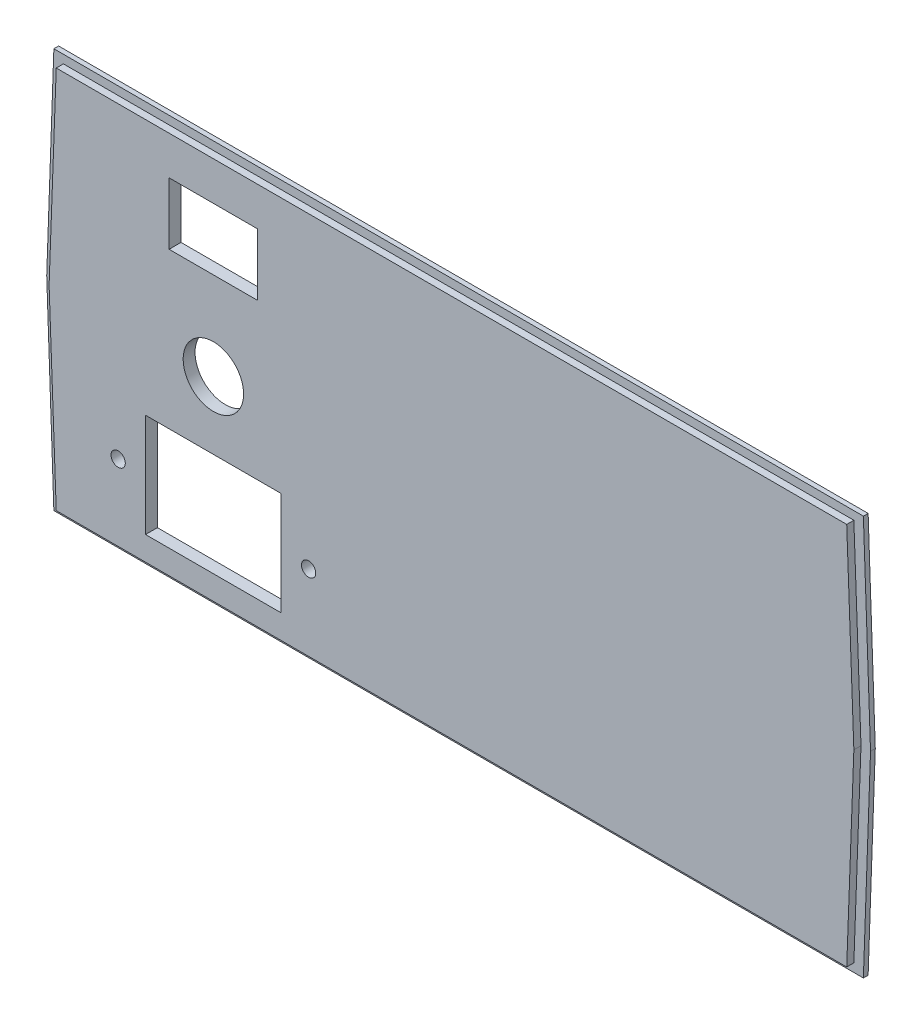
from build123d import *

# Parameters (mm, degrees)
BOSS_EXTRUDE1_DEPTH = 1
BOSS_EXTRUDE2_DEPTH = 1.5
CUT_EXTRUDE1_REACH  = 98.19
SKETCH3_R           = 1.5
SKETCH3_R_2         = 6.35
SKETCH3_W           = 28.5
SKETCH3_H           = 21.7
SKETCH3_W_2         = 18.6
SKETCH3_H_2         = 13


with BuildPart() as part:
    # Sketch1 → Boss-Extrude1 (new body)
    with BuildSketch(Plane.XY):
        Polygon((-85, 42), (85, 42), (86.5, 0), (85, -42), (-85, -42), (-86.5, 0), align=None)
    extrude(amount=BOSS_EXTRUDE1_DEPTH)

    # Sketch2 → Boss-Extrude2 (add)
    with BuildSketch(Plane.XY.offset(1)):
        Polygon((-83, 40.25), (83, 40.25), (84.5, 0), (83, -40.25), (-83, -40.25), (-84.5, 0), align=None)
    extrude(amount=BOSS_EXTRUDE2_DEPTH)

    # Sketch3 → Cut-Extrude1 (cut, up to next)
    with BuildSketch(Plane(origin=(0, 0, 0), x_dir=(-1, 0, 0), z_dir=(0, 0, -1)), mode=Mode.PRIVATE) as cut_extrude1_sk1:
        with Locations((30, -24.372809019)):
            Circle(SKETCH3_R)
    cut_extrude1_tool1 = extrude(cut_extrude1_sk1.sketch, amount=-CUT_EXTRUDE1_REACH, mode=Mode.PRIVATE) & part.part
    # Sketch3 → Cut-Extrude1 (cut, up to next)
    with BuildSketch(Plane(origin=(0, 0, 0), x_dir=(-1, 0, 0), z_dir=(0, 0, -1)), mode=Mode.PRIVATE) as cut_extrude1_sk2:
        with Locations((70, -24.372809019)):
            Circle(SKETCH3_R)
    cut_extrude1_tool2 = extrude(cut_extrude1_sk2.sketch, amount=-CUT_EXTRUDE1_REACH, mode=Mode.PRIVATE) & part.part
    # Sketch3 → Cut-Extrude1 (cut, up to next)
    with BuildSketch(Plane(origin=(0, 0, 0), x_dir=(-1, 0, 0), z_dir=(0, 0, -1)), mode=Mode.PRIVATE) as cut_extrude1_sk3:
        with Locations((50, 0.627190981)):
            Circle(SKETCH3_R_2)
    cut_extrude1_tool3 = extrude(cut_extrude1_sk3.sketch, amount=-CUT_EXTRUDE1_REACH, mode=Mode.PRIVATE) & part.part
    # Sketch3 → Cut-Extrude1 (cut, up to next)
    with BuildSketch(Plane(origin=(0, 0, 0), x_dir=(-1, 0, 0), z_dir=(0, 0, -1)), mode=Mode.PRIVATE) as cut_extrude1_sk4:
        with Locations((50, -24.372809019)):
            Rectangle(SKETCH3_W, SKETCH3_H)
    cut_extrude1_tool4 = extrude(cut_extrude1_sk4.sketch, amount=-CUT_EXTRUDE1_REACH, mode=Mode.PRIVATE) & part.part
    # Sketch3 → Cut-Extrude1 (cut, up to next)
    with BuildSketch(Plane(origin=(0, 0, 0), x_dir=(-1, 0, 0), z_dir=(0, 0, -1)), mode=Mode.PRIVATE) as cut_extrude1_sk5:
        with Locations((50, 25.627190981)):
            Rectangle(SKETCH3_W_2, SKETCH3_H_2)
    cut_extrude1_tool5 = extrude(cut_extrude1_sk5.sketch, amount=-CUT_EXTRUDE1_REACH, mode=Mode.PRIVATE) & part.part
    add(cut_extrude1_tool1.solids().sort_by_distance((-30, -24.372809, 0))[0], mode=Mode.SUBTRACT)
    add(cut_extrude1_tool2.solids().sort_by_distance((-70, -24.372809, 0))[0], mode=Mode.SUBTRACT)
    add(cut_extrude1_tool3.solids().sort_by_distance((-50, 0.627191, 0))[0], mode=Mode.SUBTRACT)
    add(cut_extrude1_tool4.solids().sort_by_distance((-50, -24.372809, 0))[0], mode=Mode.SUBTRACT)
    add(cut_extrude1_tool5.solids().sort_by_distance((-50, 25.627191, 0))[0], mode=Mode.SUBTRACT)


solid = part.part
